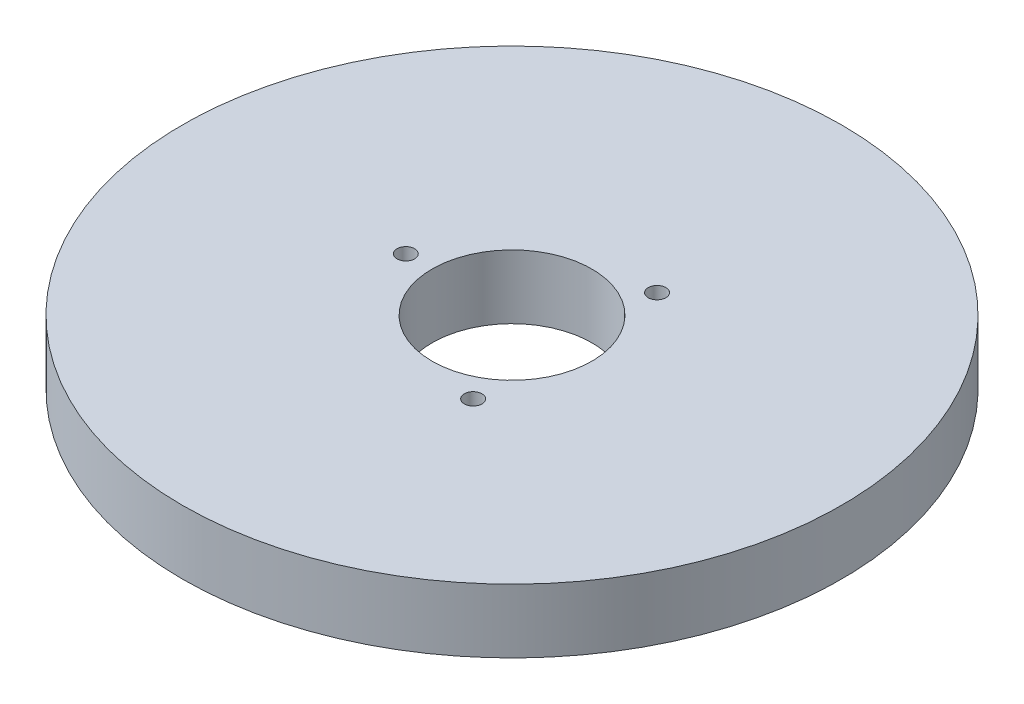
from build123d import *

# Parameters (mm, degrees)
SKETCH1_R           = 82.5
BOSS_EXTRUDE1_DEPTH = 16
SKETCH2_R           = 20
CUT_EXTRUDE1_DEPTH  = 118.764595698
SKETCH3_R           = 2.208743682
CUT_EXTRUDE2_DEPTH  = 10.356881576
CIRPATTERN1_COUNT   = 3


with BuildPart() as part:
    # Sketch1 → Boss-Extrude1 (new body)
    with BuildSketch(Plane(origin=(0, 0, 0), x_dir=(1, 0, 0), z_dir=(0, 1, 0))):
        Circle(SKETCH1_R)
    extrude(amount=BOSS_EXTRUDE1_DEPTH)

    # Sketch2 → Cut-Extrude1 (cut, through all)
    with BuildSketch(Plane(origin=(0, 0, 0), x_dir=(1, 0, 0), z_dir=(0, 1, 0))):
        Circle(SKETCH2_R)
    extrude(amount=CUT_EXTRUDE1_DEPTH, mode=Mode.SUBTRACT)

    # Sketch3 → Cut-Extrude2 (cut)
    with BuildSketch(Plane(origin=(0, 16, 0), x_dir=(1, 0, 0), z_dir=(0, 1, 0))):
        with Locations((-26.584274151, 0)):
            Circle(SKETCH3_R)
    cut_extrude2 = extrude(amount=-CUT_EXTRUDE2_DEPTH, mode=Mode.SUBTRACT)

    # CirPattern1: Cut-Extrude2 ×3 about axis
    cirpattern1_axis = Axis((0, 0, 0), (0, 1, 0))
    for i in range(1, CIRPATTERN1_COUNT):
        add(cut_extrude2.rotate(cirpattern1_axis, i * 360 / CIRPATTERN1_COUNT), mode=Mode.SUBTRACT)


solid = part.part
